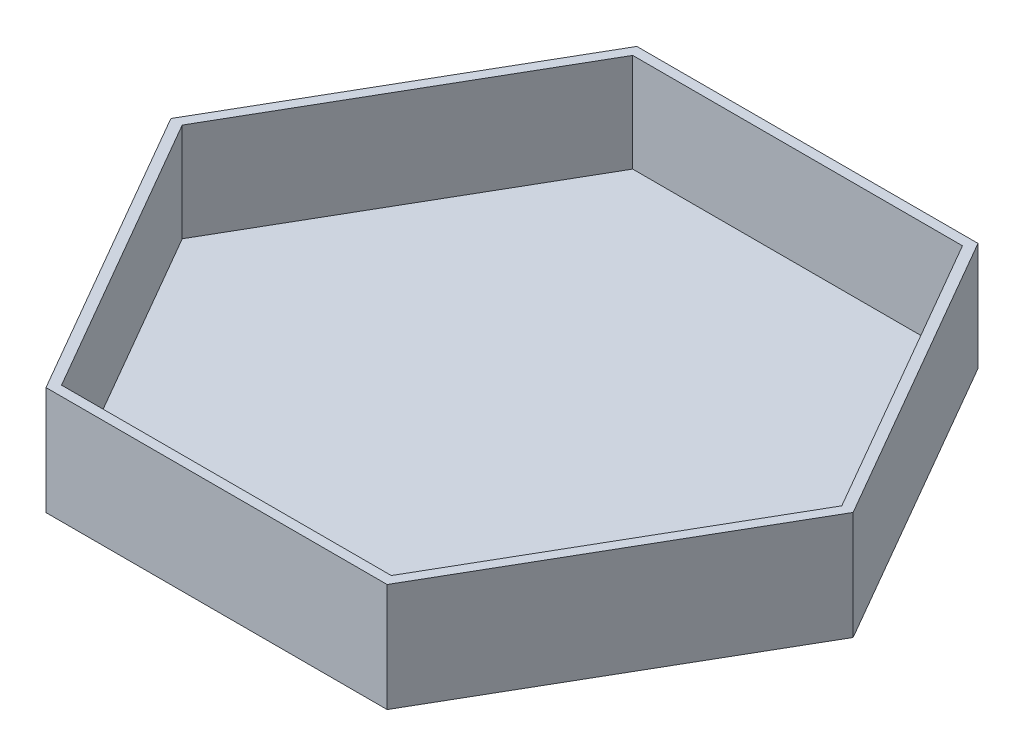
from build123d import *

# Parameters (mm, degrees)
BOSS_EXTRUDE1_DEPTH = 55
SHELL1_T            = -5


with BuildPart() as part:
    # Sketch1 → Boss-Extrude1 (new body)
    with BuildSketch(Plane(origin=(0, 0, 0), x_dir=(1, 0, 0), z_dir=(0, 1, 0))):
        Polygon((173.205080757, 0), (86.602540378, 150), (-86.602540378, 150), (-173.205080757, 0), (-86.602540378, -150), (86.602540378, -150), align=None)
    extrude(amount=BOSS_EXTRUDE1_DEPTH)

    # Shell1
    shell1_openings = [part.faces().sort_by_distance(p)[0] for p in [
        (0, 55, 0),
    ]]
    offset(amount=SHELL1_T, openings=shell1_openings, kind=Kind.INTERSECTION)


solid = part.part
